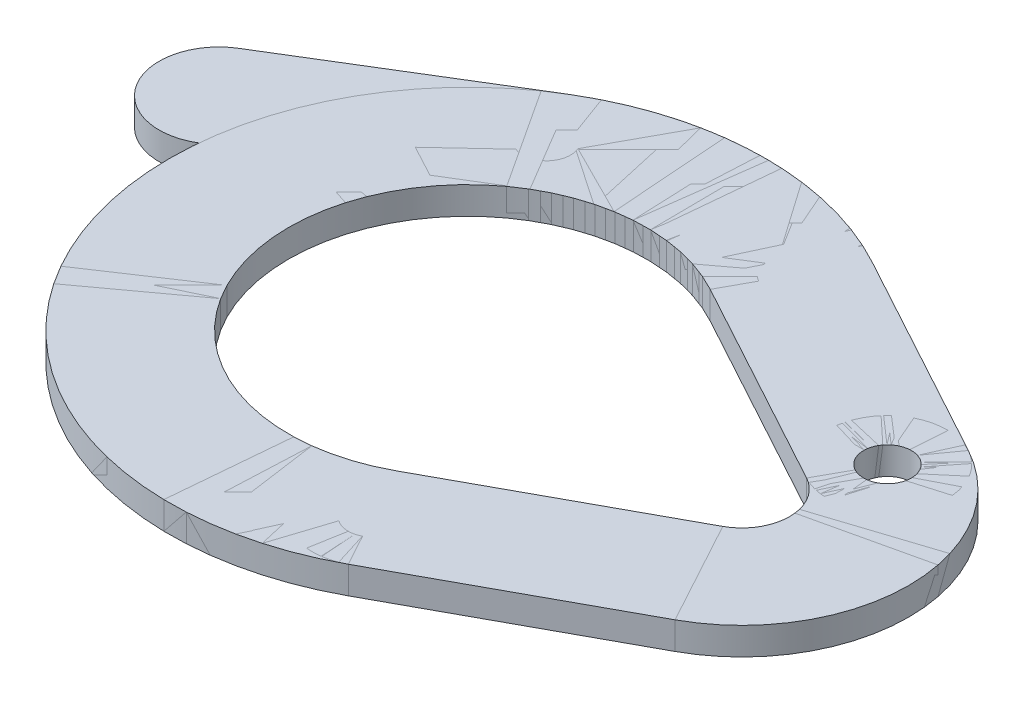
from build123d import *

# Parameters (mm, degrees)
SKETCH8_R          = 2
BASE_FLANGE2_DEPTH = 2.3
SKETCH14_R         = 2
BASE_FLANGE4_DEPTH = 2.3
SKETCH17_R         = 2
BASE_FLANGE5_DEPTH = 2.3
SKETCH11_R         = 2
BASE_FLANGE6_DEPTH = 2.3
SKETCH23_R         = 2
BASE_FLANGE7_DEPTH = 2.3


# Sheet-metal steps are written as plain solids
with BuildPart() as part:
    # Sketch8 → Base-Flange2 (new body)
    with BuildSketch(Plane(origin=(0, 0, 0), x_dir=(1, 0, 0), z_dir=(0, 1, 0))):
        with BuildLine():
            ThreePointArc((11.956521739, 21.955445518), (-25, 0), (11.956521739, -21.955445518))
            ThreePointArc((11.956521739, -21.955445518), (13.956306495, -15.173052067), (7.173913043, -13.173267311))
            ThreePointArc((7.173913043, -13.173267311), (-15, 0), (7.173913043, 13.173267311))
            ThreePointArc((7.173913043, 13.173267311), (13.956306495, 15.173052067), (11.956521739, 21.955445518))
        make_face()
        with Locations(Location((9.565217391, 17.564356415, 0), (0, 0, 270))):
            Circle(SKETCH8_R, mode=Mode.SUBTRACT)
        with Locations(Location((9.565217391, -17.564356415, 0), (0, 0, 270))):
            Circle(SKETCH8_R, mode=Mode.SUBTRACT)
    extrude(amount=-BASE_FLANGE2_DEPTH)


with BuildPart() as body_2:
    # Sketch14 → Base-Flange4 (new body)
    with BuildSketch(Plane(origin=(0, 0, 0), x_dir=(1, 0, 0), z_dir=(0, 1, 0))):
        with BuildLine():
            Line((29.695652174, 12.29504949), (11.956521739, 21.955445518))
            ThreePointArc((11.956521739, 21.955445518), (-0.623071192, 24.99223444), (-13.035712701, 21.332374326))
            ThreePointArc((-13.035712701, 21.332374326), (-14.695045026, 14.458756921), (-7.82142762, 12.799424596))
            ThreePointArc((-7.82142762, 12.799424596), (-0.373842715, 14.995340664), (7.173913043, 13.173267311))
            Line((7.173913043, 13.173267311), (24.913043478, 3.512871283))
            ThreePointArc((24.913043478, 3.512871283), (31.69543693, 5.512656039), (29.695652174, 12.29504949))
        make_face()
        with Locations(Location((-10.42857016, 17.065899461, 0), (0, 0, 270))):
            Circle(SKETCH14_R, mode=Mode.SUBTRACT)
        with Locations(Location((27.304347826, 7.903960387, 0), (0, 0, 270))):
            Circle(SKETCH14_R, mode=Mode.SUBTRACT)
    extrude(amount=-BASE_FLANGE4_DEPTH)


with BuildPart() as body_3:
    # Sketch17 → Base-Flange5 (new body)
    with BuildSketch(Plane(origin=(0, 0, 0), x_dir=(1, 0, 0), z_dir=(0, 1, 0))):
        with BuildLine():
            Line((-13.035712701, 21.332374326), (-30.101612161, 10.903804166))
            ThreePointArc((-30.101612161, 10.903804166), (-31.760944487, 4.03018676), (-24.887327081, 2.370854435))
            Line((-24.887327081, 2.370854435), (-7.82142762, 12.799424596))
            ThreePointArc((-7.82142762, 12.799424596), (-0.373842715, 14.995340664), (7.173913043, 13.173267311))
            ThreePointArc((7.173913043, 13.173267311), (13.956306495, 15.173052067), (11.956521739, 21.955445518))
            ThreePointArc((11.956521739, 21.955445518), (-0.623071192, 24.99223444), (-13.035712701, 21.332374326))
        make_face()
        with Locations(Location((9.565217391, 17.564356415, 0), (0, 0, 270))):
            Circle(SKETCH17_R, mode=Mode.SUBTRACT)
        with Locations(Location((-10.42857016, 17.065899461, 0), (0, 0, 270))):
            Circle(SKETCH17_R, mode=Mode.SUBTRACT)
    extrude(amount=-BASE_FLANGE5_DEPTH)


with BuildPart() as body_4:
    # Sketch11 → Base-Flange6 (new body)
    with BuildSketch(Plane(origin=(0, 0, 0), x_dir=(1, 0, 0), z_dir=(0, 1, 0))):
        with BuildLine():
            Line((11.956521739, -21.955445518), (29.695652174, -12.29504949))
            ThreePointArc((29.695652174, -12.29504949), (37, 0), (29.695652174, 12.29504949))
            ThreePointArc((29.695652174, 12.29504949), (22.913258722, 10.295264734), (24.913043478, 3.512871283))
            ThreePointArc((24.913043478, 3.512871283), (27, 0), (24.913043478, -3.512871283))
            Line((24.913043478, -3.512871283), (7.173913043, -13.173267311))
            ThreePointArc((7.173913043, -13.173267311), (5.174128288, -19.955660762), (11.956521739, -21.955445518))
        make_face()
        with Locations(Location((27.304347826, 7.903960387, 0), (0, 0, 270))):
            Circle(SKETCH11_R, mode=Mode.SUBTRACT)
        with Locations(Location((9.565217391, -17.564356415, 0), (0, 0, 270))):
            Circle(SKETCH11_R, mode=Mode.SUBTRACT)
    extrude(amount=-BASE_FLANGE6_DEPTH)


with BuildPart() as body_5:
    # Sketch23 → Base-Flange7 (new body)
    with BuildSketch(Plane(origin=(0, 0, 0), x_dir=(1, 0, 0), z_dir=(0, 1, 0))):
        with BuildLine():
            Line((11.956521739, -21.955445518), (29.695652174, -12.29504949))
            ThreePointArc((29.695652174, -12.29504949), (37, 0), (29.695652174, 12.29504949))
            ThreePointArc((29.695652174, 12.29504949), (22.913258722, 10.295264734), (24.913043478, 3.512871283))
            ThreePointArc((24.913043478, 3.512871283), (27, 0), (24.913043478, -3.512871283))
            Line((24.913043478, -3.512871283), (7.173913043, -13.173267311))
            ThreePointArc((7.173913043, -13.173267311), (-15, 0), (7.173913043, 13.173267311))
            ThreePointArc((7.173913043, 13.173267311), (13.956306495, 15.173052067), (11.956521739, 21.955445518))
            ThreePointArc((11.956521739, 21.955445518), (-25, 0), (11.956521739, -21.955445518))
        make_face()
        with Locations(Location((9.565217391, 17.564356415, 0), (0, 0, 270))):
            Circle(SKETCH23_R, mode=Mode.SUBTRACT)
        with Locations(Location((27.304347826, 7.903960387, 0), (0, 0, 270))):
            Circle(SKETCH23_R, mode=Mode.SUBTRACT)
    extrude(amount=-BASE_FLANGE7_DEPTH)


solid = Compound([part.part, body_2.part, body_3.part, body_4.part, body_5.part])
